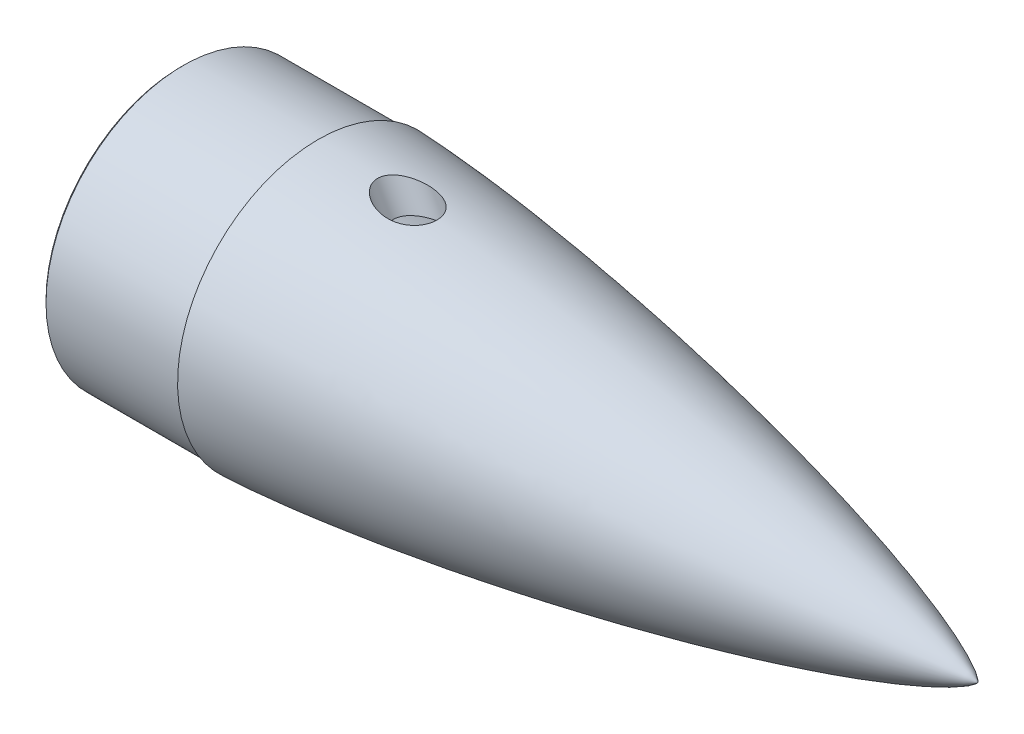
from build123d import *

# Parameters (mm, degrees)
CHAMFER1_SIZE                   = 1.5
TAP_DRILL_FOR_1_HELICOIL1_D     = 6.7564
TAP_DRILL_FOR_1_HELICOIL1_DEPTH = 9.525
CIRPATTERN1_COUNT               = 6
SKETCH26_R                      = 15
CUT_EXTRUDE5_DEPTH              = 50
CUT_EXTRUDE6_START              = 50
SKETCH26_2_R                    = 15
CUT_EXTRUDE6_DEPTH              = 50


with BuildPart() as part:
    # Sketch10 → Revolve1 (revolve)
    with BuildSketch(Plane.XY):
        with BuildLine():
            Line((11.112493743, 81.99983), (11.112493743, 67.49983))
            Line((11.112493743, 67.49983), (129.304508698, 67.49983))
            add(Edge.make_bspline(
                [(368.967251823, 0), (368.965299543, 0.012338489), (368.959416882, 0.036518378), (368.940636147, 0.082964007), (368.902304552, 0.158736421), (368.845538097, 0.250270687), (368.755690124, 0.376555746), (368.616653262, 0.54835284), (368.392888737, 0.793577299), (368.008659121, 1.164904965), (367.344738263, 1.729853685), (366.176060796, 2.601559154), (364.09282389, 3.960032328), (360.425978756, 6.040734396), (354.402196649, 9.01831007), (344.042994901, 13.507695011), (329.152005398, 19.128483965), (310.425167902, 25.398569259), (288.741266406, 31.933693508), (266.378532845, 38.106125474), (243.901379123, 43.846895186), (221.331994001, 49.212017941), (198.683967629, 54.234500927), (175.966897581, 58.934255644), (156.034567874, 62.771715365), (141.509051931, 65.395628269), (132.679425236, 66.924517444), (129.562757302, 67.455859883), (129.304508698, 67.49983)],
                knots=[0, 0, 0, 0, 0, 0.000134949, 0.000269899, 0.000539798, 0.000919537, 0.001299277, 0.001947431, 0.00293136, 0.004511869, 0.007081312, 0.011380263, 0.018707867, 0.031423867, 0.052705479, 0.084103008, 0.140910136, 0.203703492, 0.266497064, 0.329290816, 0.392084375, 0.454877964, 0.517671564, 0.580465191, 0.643258828, 0.674655593, 0.677492072, 0.677492072, 0.677492072, 0.677492072, 0.677492072], degree=4))
            Line((368.967251823, 0), (408.967251823, 0))
            add(Edge.make_bspline(
                [(408.967251823, 0), (408.964913524, 0.013501739), (408.958040758, 0.039916077), (408.936520441, 0.090485698), (408.892222076, 0.174057132), (408.826281575, 0.275556803), (408.721696416, 0.415833756), (408.561101809, 0.605075245), (408.30561918, 0.87242415), (407.86966713, 1.275299562), (407.120955138, 1.885142115), (405.803773451, 2.82590185), (403.46240692, 4.287152794), (399.325294488, 6.531818454), (392.481146888, 9.758904649), (380.662076725, 14.628008466), (363.637187185, 20.711720382), (342.215241093, 27.476512989), (317.428462321, 34.49762647), (291.879335737, 41.10482439), (266.21046092, 47.228993169), (240.44548836, 52.933436777), (214.598861982, 58.255439009), (188.68089566, 63.217582693), (165.946174917, 67.253280679), (146.421982586, 70.493799722), (130.127893898, 73.044947468), (117.078590637, 74.994157933), (104.015464216, 76.84854079), (92.573263959, 78.384492045), (82.757139441, 79.635603973), (74.571340184, 80.632219902), (68.019260454, 81.400804211), (61.463723364, 82.139375899), (54.90469802, 82.84637726), (48.342159918, 83.519940506), (41.776057559, 84.15778717), (36.02754108, 84.682157239), (31.097921259, 85.105234912), (26.988317923, 85.438669825), (23.699666618, 85.693218594), (20.085807822, 85.958448038), (16.719873821, 86.189018485), (13.602098287, 86.386966779), (10.732704013, 86.554575744), (8.436635008, 86.678703291), (6.139997341, 86.792157585), (4.129892063, 86.879313264), (2.40653858, 86.944618982), (1.257348635, 86.979022496), (0.68269791, 86.99491462), (0.395312527, 86.99983)],
                knots=[0, 0, 0, 0, 0, 0.000130123, 0.000260245, 0.000520491, 0.000900391, 0.00128029, 0.001925099, 0.002881508, 0.004418208, 0.006927086, 0.011110697, 0.018279138, 0.03067276, 0.051704469, 0.08310228, 0.139908797, 0.202702513, 0.265496165, 0.328289682, 0.391083359, 0.453876973, 0.516670577, 0.579464197, 0.642257765, 0.673654596, 0.705051427, 0.736448267, 0.767845106, 0.799241874, 0.814940257, 0.830638641, 0.846337073, 0.862035505, 0.877733936, 0.893432368, 0.90913072, 0.924829072, 0.932678248, 0.940527424, 0.9483766, 0.956225776, 0.967169332, 0.97264111, 0.978112888, 0.983584666, 0.989056444, 0.994528222, 0.997264111, 1, 1, 1, 1, 1], degree=4))
            Line((0.395312527, 86.99983), (0.395312527, 84.99983))
            Line((0.395312527, 84.99983), (-84.604517473, 84.99983))
            Line((-84.604517473, 84.99983), (-84.604517473, 81.99983))
            Line((-84.604517473, 81.99983), (11.112493743, 81.99983))
        make_face()
    revolve(axis=Axis((46.917858469, 0, 0), (-1, 0, 0)))

    # Chamfer1
    chamfer1_edges = [part.edges().sort_by_distance(p)[0] for p in [
        (-84.604517473, -84.99983, 0),
    ]]
    chamfer(chamfer1_edges, length=CHAMFER1_SIZE)

    # Tap Drill for #1 Helicoil1
    with Locations(Plane.ZY.offset(-11.112493743)):
        with Locations((-37.374915, 64.735251709)):
            tap_drill_for_1_helicoil1 = Hole(TAP_DRILL_FOR_1_HELICOIL1_D / 2, depth=TAP_DRILL_FOR_1_HELICOIL1_DEPTH)

    # CirPattern1: Tap Drill for #1 Helicoil1 ×6 about axis
    cirpattern1_axis = Axis((11.112493743, 0, 0), (1, 0, 0))
    for i in range(1, CIRPATTERN1_COUNT):
        add(tap_drill_for_1_helicoil1.rotate(cirpattern1_axis, i * 360 / CIRPATTERN1_COUNT), mode=Mode.SUBTRACT)

    # Sketch26 → Cut-Extrude5 (cut)
    with BuildSketch(Plane(origin=(-16.431060981, 28.459432441, 0), x_dir=(0, 0, 1), z_dir=(-0.500000000000001, 0.866025403784438, 0))):
        with Locations((0, 89.525578438)):
            Circle(SKETCH26_R)
    extrude(amount=-CUT_EXTRUDE5_DEPTH, mode=Mode.SUBTRACT)

    # Sketch26<2> → Cut-Extrude6 (cut)
    with BuildSketch(Plane(origin=(-16.431060981, 28.459432441, 0), x_dir=(0, 0, 1), z_dir=(-0.500000000000001, 0.866025403784438, 0)).offset(CUT_EXTRUDE6_START)):
        with Locations((0, 89.525578438)):
            Circle(SKETCH26_2_R)
    extrude(amount=-CUT_EXTRUDE6_DEPTH, mode=Mode.SUBTRACT)


solid = part.part
